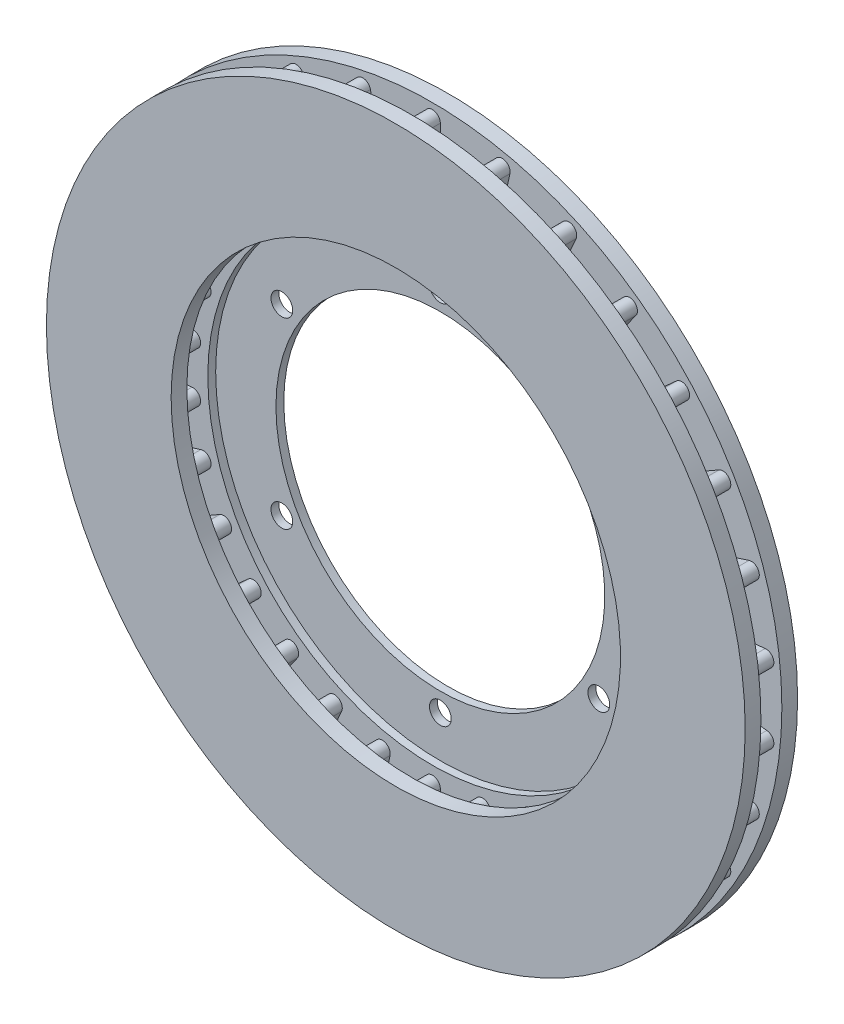
from build123d import *

# Parameters (mm, degrees)
SKETCH1_R               = 133.35
SKETCH1_R_2             = 85.75
EXTRUDE1_DEPTH          = 20
SKETCH2_R               = 85.75
SKETCH2_R_2             = 62.75
EXTRUDE2_DEPTH          = 3
SKETCH3_R               = 4.15
EXTRUDE7_DEPTH          = 11
CUT_EXTRUDE1_DEPTH      = 4
CUT_EXTRUDE1_DEPTH_BACK = 4
SKETCH5_OUTSIDE_W       = 344.24
SKETCH5_OUTSIDE_H       = 344.24


with BuildPart() as part:
    # Sketch1 → Extrude1 (new body)
    with BuildSketch(Plane.XY):
        Circle(SKETCH1_R)
        Circle(SKETCH1_R_2, mode=Mode.SUBTRACT)
    extrude(amount=EXTRUDE1_DEPTH)

    # Sketch2 → Extrude2 (add)
    with BuildSketch(Plane.XY):
        Circle(SKETCH2_R)
        Circle(SKETCH2_R_2, mode=Mode.SUBTRACT)
    extrude(amount=EXTRUDE2_DEPTH)

    # Sketch3 → Extrude7 (cut)
    with BuildSketch(Plane.XY):
        with Locations((0, 69.85)):
            Circle(SKETCH3_R)
        with Locations((60.491874454, 34.925)):
            Circle(SKETCH3_R)
        with Locations((60.491874454, -34.925)):
            Circle(SKETCH3_R)
        with Locations((0, -69.85)):
            Circle(SKETCH3_R)
        with Locations((-60.491874454, -34.925)):
            Circle(SKETCH3_R)
        with Locations((-60.491874454, 34.925)):
            Circle(SKETCH3_R)
    extrude(amount=EXTRUDE7_DEPTH, mode=Mode.SUBTRACT)

    # Sketch5 outside → Cut-Extrude1 (cut, two sides: drawn at the far end of the back side and taken through both)
    with BuildSketch(Plane.XY.offset(10).offset(-CUT_EXTRUDE1_DEPTH_BACK)):
        Rectangle(SKETCH5_OUTSIDE_W, SKETCH5_OUTSIDE_H)
        with BuildLine():
            Line((3, 128), (3, 92))
            ThreePointArc((3, 92), (0, 89), (-3, 92))
            Line((-3, 92), (-3, 128))
            ThreePointArc((-3, 128), (0, 131), (3, 128))
        make_face(mode=Mode.SUBTRACT)
        with BuildLine():
            Line((29.547139227, 124.579157821), (22.062318357, 89.365844195))
            ThreePointArc((22.062318357, 89.365844195), (18.504140483, 87.055136465), (16.193432753, 90.61331434))
            Line((16.193432753, 90.61331434), (23.678253622, 125.826627966))
            ThreePointArc((23.678253622, 125.826627966), (27.236431497, 128.137335696), (29.547139227, 124.579157821))
        make_face(mode=Mode.SUBTRACT)
        with BuildLine():
            Line((54.802926687, 115.713608649), (40.160407536, 82.825972174))
            ThreePointArc((40.160407536, 82.825972174), (36.199561234, 81.30554573), (34.67913479, 85.266392032))
            Line((34.67913479, 85.266392032), (49.321653941, 118.154028507))
            ThreePointArc((49.321653941, 118.154028507), (53.282500243, 119.674454951), (54.802926687, 115.713608649))
        make_face(mode=Mode.SUBTRACT)
        with BuildLine():
            Line((77.663563277, 101.790819523), (56.503294194, 72.666207726))
            ThreePointArc((56.503294194, 72.666207726), (52.312887454, 72.002512499), (51.649192228, 76.192919239))
            Line((51.649192228, 76.192919239), (72.80946131, 105.317531037))
            ThreePointArc((72.80946131, 105.317531037), (76.99986805, 105.981226263), (77.663563277, 101.790819523))
        make_face(mode=Mode.SUBTRACT)
        with BuildLine():
            Line((97.12992948, 83.419283138), (70.376715763, 59.330581309))
            ThreePointArc((70.376715763, 59.330581309), (66.139889467, 59.552623966), (66.361932125, 63.789450261))
            Line((66.361932125, 63.789450261), (93.115145842, 87.87815209))
            ThreePointArc((93.115145842, 87.87815209), (97.351972138, 87.656109433), (97.12992948, 83.419283138))
        make_face(mode=Mode.SUBTRACT)
        with BuildLine():
            Line((112.351251684, 61.401923789), (81.174337148, 43.401923789))
            ThreePointArc((81.174337148, 43.401923789), (77.076260937, 44.5), (78.174337148, 48.598076211))
            Line((78.174337148, 48.598076211), (109.351251684, 66.598076211))
            ThreePointArc((109.351251684, 66.598076211), (113.449327896, 65.5), (112.351251684, 61.401923789))
        make_face(mode=Mode.SUBTRACT)
        with BuildLine():
            Line((122.662285069, 36.701005731), (88.424250482, 25.576393934))
            ThreePointArc((88.424250482, 25.576393934), (84.64402995, 27.502512499), (86.570148516, 31.282733031))
            Line((86.570148516, 31.282733031), (120.808183103, 42.407344829))
            ThreePointArc((120.808183103, 42.407344829), (124.588403635, 40.481226263), (122.662285069, 36.701005731))
        make_face(mode=Mode.SUBTRACT)
        with BuildLine():
            Line((127.612387997, 10.396077612), (91.809599764, 6.633052935))
            ThreePointArc((91.809599764, 6.633052935), (88.512448688, 9.303033231), (91.182428984, 12.600184307))
            Line((91.182428984, 12.600184307), (126.985217217, 16.363208984))
            ThreePointArc((126.985217217, 16.363208984), (130.282368293, 13.693228688), (127.612387997, 10.396077612))
        make_face(mode=Mode.SUBTRACT)
        with BuildLine():
            Line((126.985217217, -16.363208984), (91.182428984, -12.600184307))
            ThreePointArc((91.182428984, -12.600184307), (88.512448688, -9.303033231), (91.809599764, -6.633052935))
            Line((91.809599764, -6.633052935), (127.612387997, -10.396077612))
            ThreePointArc((127.612387997, -10.396077612), (130.282368293, -13.693228688), (126.985217217, -16.363208984))
        make_face(mode=Mode.SUBTRACT)
        with BuildLine():
            Line((120.808183103, -42.407344829), (86.570148516, -31.282733031))
            ThreePointArc((86.570148516, -31.282733031), (84.64402995, -27.502512499), (88.424250482, -25.576393934))
            Line((88.424250482, -25.576393934), (122.662285069, -36.701005731))
            ThreePointArc((122.662285069, -36.701005731), (124.588403635, -40.481226263), (120.808183103, -42.407344829))
        make_face(mode=Mode.SUBTRACT)
        with BuildLine():
            Line((109.351251684, -66.598076211), (78.174337148, -48.598076211))
            ThreePointArc((78.174337148, -48.598076211), (77.076260937, -44.5), (81.174337148, -43.401923789))
            Line((81.174337148, -43.401923789), (112.351251684, -61.401923789))
            ThreePointArc((112.351251684, -61.401923789), (113.449327896, -65.5), (109.351251684, -66.598076211))
        make_face(mode=Mode.SUBTRACT)
        with BuildLine():
            Line((93.115145842, -87.87815209), (66.361932125, -63.789450261))
            ThreePointArc((66.361932125, -63.789450261), (66.139889467, -59.552623966), (70.376715763, -59.330581309))
            Line((70.376715763, -59.330581309), (97.12992948, -83.419283138))
            ThreePointArc((97.12992948, -83.419283138), (97.351972138, -87.656109433), (93.115145842, -87.87815209))
        make_face(mode=Mode.SUBTRACT)
        with BuildLine():
            Line((72.80946131, -105.317531037), (51.649192228, -76.192919239))
            ThreePointArc((51.649192228, -76.192919239), (52.312887454, -72.002512499), (56.503294194, -72.666207726))
            Line((56.503294194, -72.666207726), (77.663563277, -101.790819523))
            ThreePointArc((77.663563277, -101.790819523), (76.99986805, -105.981226263), (72.80946131, -105.317531037))
        make_face(mode=Mode.SUBTRACT)
        with BuildLine():
            Line((49.321653941, -118.154028507), (34.67913479, -85.266392032))
            ThreePointArc((34.67913479, -85.266392032), (36.199561234, -81.30554573), (40.160407536, -82.825972174))
            Line((40.160407536, -82.825972174), (54.802926687, -115.713608649))
            ThreePointArc((54.802926687, -115.713608649), (53.282500243, -119.674454951), (49.321653941, -118.154028507))
        make_face(mode=Mode.SUBTRACT)
        with BuildLine():
            Line((23.678253622, -125.826627966), (16.193432753, -90.61331434))
            ThreePointArc((16.193432753, -90.61331434), (18.504140483, -87.055136465), (22.062318357, -89.365844195))
            Line((22.062318357, -89.365844195), (29.547139227, -124.579157821))
            ThreePointArc((29.547139227, -124.579157821), (27.236431497, -128.137335696), (23.678253622, -125.826627966))
        make_face(mode=Mode.SUBTRACT)
        with BuildLine():
            Line((-3, -128), (-3, -92))
            ThreePointArc((-3, -92), (0, -89), (3, -92))
            Line((3, -92), (3, -128))
            ThreePointArc((3, -128), (0, -131), (-3, -128))
        make_face(mode=Mode.SUBTRACT)
        with BuildLine():
            Line((-29.547139227, -124.579157821), (-22.062318357, -89.365844195))
            ThreePointArc((-22.062318357, -89.365844195), (-18.504140483, -87.055136465), (-16.193432753, -90.61331434))
            Line((-16.193432753, -90.61331434), (-23.678253622, -125.826627966))
            ThreePointArc((-23.678253622, -125.826627966), (-27.236431497, -128.137335696), (-29.547139227, -124.579157821))
        make_face(mode=Mode.SUBTRACT)
        with BuildLine():
            Line((-54.802926687, -115.713608649), (-40.160407536, -82.825972174))
            ThreePointArc((-40.160407536, -82.825972174), (-36.199561234, -81.30554573), (-34.67913479, -85.266392032))
            Line((-34.67913479, -85.266392032), (-49.321653941, -118.154028507))
            ThreePointArc((-49.321653941, -118.154028507), (-53.282500243, -119.674454951), (-54.802926687, -115.713608649))
        make_face(mode=Mode.SUBTRACT)
        with BuildLine():
            Line((-77.663563277, -101.790819523), (-56.503294194, -72.666207726))
            ThreePointArc((-56.503294194, -72.666207726), (-52.312887454, -72.002512499), (-51.649192228, -76.192919239))
            Line((-51.649192228, -76.192919239), (-72.80946131, -105.317531037))
            ThreePointArc((-72.80946131, -105.317531037), (-76.99986805, -105.981226263), (-77.663563277, -101.790819523))
        make_face(mode=Mode.SUBTRACT)
        with BuildLine():
            Line((-97.12992948, -83.419283138), (-70.376715763, -59.330581309))
            ThreePointArc((-70.376715763, -59.330581309), (-66.139889467, -59.552623966), (-66.361932125, -63.789450261))
            Line((-66.361932125, -63.789450261), (-93.115145842, -87.87815209))
            ThreePointArc((-93.115145842, -87.87815209), (-97.351972138, -87.656109433), (-97.12992948, -83.419283138))
        make_face(mode=Mode.SUBTRACT)
        with BuildLine():
            Line((-112.351251684, -61.401923789), (-81.174337148, -43.401923789))
            ThreePointArc((-81.174337148, -43.401923789), (-77.076260937, -44.5), (-78.174337148, -48.598076211))
            Line((-78.174337148, -48.598076211), (-109.351251684, -66.598076211))
            ThreePointArc((-109.351251684, -66.598076211), (-113.449327896, -65.5), (-112.351251684, -61.401923789))
        make_face(mode=Mode.SUBTRACT)
        with BuildLine():
            Line((-122.662285069, -36.701005731), (-88.424250482, -25.576393934))
            ThreePointArc((-88.424250482, -25.576393934), (-84.64402995, -27.502512499), (-86.570148516, -31.282733031))
            Line((-86.570148516, -31.282733031), (-120.808183103, -42.407344829))
            ThreePointArc((-120.808183103, -42.407344829), (-124.588403635, -40.481226263), (-122.662285069, -36.701005731))
        make_face(mode=Mode.SUBTRACT)
        with BuildLine():
            Line((-127.612387997, -10.396077612), (-91.809599764, -6.633052935))
            ThreePointArc((-91.809599764, -6.633052935), (-88.512448688, -9.303033231), (-91.182428984, -12.600184307))
            Line((-91.182428984, -12.600184307), (-126.985217217, -16.363208984))
            ThreePointArc((-126.985217217, -16.363208984), (-130.282368293, -13.693228688), (-127.612387997, -10.396077612))
        make_face(mode=Mode.SUBTRACT)
        with BuildLine():
            Line((-126.985217217, 16.363208984), (-91.182428984, 12.600184307))
            ThreePointArc((-91.182428984, 12.600184307), (-88.512448688, 9.303033231), (-91.809599764, 6.633052935))
            Line((-91.809599764, 6.633052935), (-127.612387997, 10.396077612))
            ThreePointArc((-127.612387997, 10.396077612), (-130.282368293, 13.693228688), (-126.985217217, 16.363208984))
        make_face(mode=Mode.SUBTRACT)
        with BuildLine():
            Line((-120.808183103, 42.407344829), (-86.570148516, 31.282733031))
            ThreePointArc((-86.570148516, 31.282733031), (-84.64402995, 27.502512499), (-88.424250482, 25.576393934))
            Line((-88.424250482, 25.576393934), (-122.662285069, 36.701005731))
            ThreePointArc((-122.662285069, 36.701005731), (-124.588403635, 40.481226263), (-120.808183103, 42.407344829))
        make_face(mode=Mode.SUBTRACT)
        with BuildLine():
            Line((-109.351251684, 66.598076211), (-78.174337148, 48.598076211))
            ThreePointArc((-78.174337148, 48.598076211), (-77.076260937, 44.5), (-81.174337148, 43.401923789))
            Line((-81.174337148, 43.401923789), (-112.351251684, 61.401923789))
            ThreePointArc((-112.351251684, 61.401923789), (-113.449327896, 65.5), (-109.351251684, 66.598076211))
        make_face(mode=Mode.SUBTRACT)
        with BuildLine():
            Line((-93.115145842, 87.87815209), (-66.361932125, 63.789450261))
            ThreePointArc((-66.361932125, 63.789450261), (-66.139889467, 59.552623966), (-70.376715763, 59.330581309))
            Line((-70.376715763, 59.330581309), (-97.12992948, 83.419283138))
            ThreePointArc((-97.12992948, 83.419283138), (-97.351972138, 87.656109433), (-93.115145842, 87.87815209))
        make_face(mode=Mode.SUBTRACT)
        with BuildLine():
            Line((-72.80946131, 105.317531037), (-51.649192228, 76.192919239))
            ThreePointArc((-51.649192228, 76.192919239), (-52.312887454, 72.002512499), (-56.503294194, 72.666207726))
            Line((-56.503294194, 72.666207726), (-77.663563277, 101.790819523))
            ThreePointArc((-77.663563277, 101.790819523), (-76.99986805, 105.981226263), (-72.80946131, 105.317531037))
        make_face(mode=Mode.SUBTRACT)
        with BuildLine():
            Line((-49.321653941, 118.154028507), (-34.67913479, 85.266392032))
            ThreePointArc((-34.67913479, 85.266392032), (-36.199561234, 81.30554573), (-40.160407536, 82.825972174))
            Line((-40.160407536, 82.825972174), (-54.802926687, 115.713608649))
            ThreePointArc((-54.802926687, 115.713608649), (-53.282500243, 119.674454951), (-49.321653941, 118.154028507))
        make_face(mode=Mode.SUBTRACT)
        with BuildLine():
            Line((-23.678253622, 125.826627966), (-16.193432753, 90.61331434))
            ThreePointArc((-16.193432753, 90.61331434), (-18.504140483, 87.055136465), (-22.062318357, 89.365844195))
            Line((-22.062318357, 89.365844195), (-29.547139227, 124.579157821))
            ThreePointArc((-29.547139227, 124.579157821), (-27.236431497, 128.137335696), (-23.678253622, 125.826627966))
        make_face(mode=Mode.SUBTRACT)
    extrude(amount=CUT_EXTRUDE1_DEPTH + CUT_EXTRUDE1_DEPTH_BACK, mode=Mode.SUBTRACT)


solid = part.part
